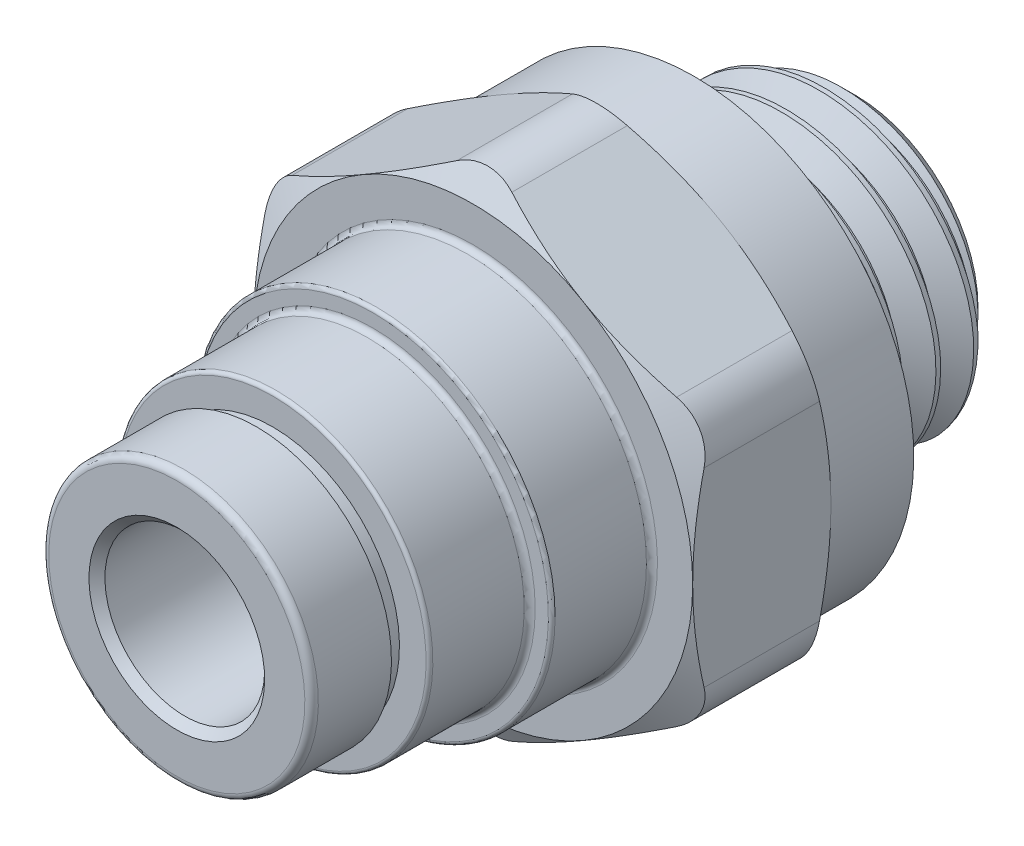
from build123d import *

# Parameters (mm, degrees)
SKETCH3_R               = 3.175
BOSS_EXTRUDE1_DEPTH     = 5.49275
SKETCH4_OUTSIDE_W       = 100.59
SKETCH4_OUTSIDE_H       = 103.292
SKETCH4_OUTSIDE_R       = 8.73125
CUT_EXTRUDE1_DEPTH      = 21.228952698
CUT_EXTRUDE1_DRAFT      = -60
MIRROR1_COPY_1_SKETCH_W = 100.59
MIRROR1_COPY_1_SKETCH_H = 103.292
MIRROR1_COPY_1_SKETCH_R = 8.73125
MIRROR1_COPY_1_DEPTH    = 21.228952698
MIRROR1_COPY_1_DRAFT    = -60
FILLET1_R               = 2.1828125
SPLIT1_SURFACE_1_BACK   = 38.591
SPLIT1_SURFACE_1_DEPTH  = 77.182
SPLIT1_SURFACE_2_BACK   = 38.591
SPLIT1_SURFACE_2_DEPTH  = 77.182
CUT_SWEEP1_PITCH        = 1.5
SKETCH5_OUTSIDE_W       = 88.964
SKETCH5_OUTSIDE_H       = 90.99
SKETCH5_OUTSIDE_R       = 4.863341658
CUT_EXTRUDE2_DEPTH      = 30.99185234
CUT_EXTRUDE2_DRAFT      = -45


with BuildPart() as part:
    # Sketch2 → Revolve1 (revolve)
    with BuildSketch(Plane(origin=(0, 0, 0), x_dir=(0, 0, -1), z_dir=(1, 0, 0))):
        with BuildLine():
            Line((-13.49375, 3.4925), (-13.49375, 5.09143))
            ThreePointArc((-13.49375, 5.09143), (-13.415263404, 5.280913404), (-13.22578, 5.3594))
            Line((-13.22578, 5.3594), (-10.31875, 5.3594))
            Line((-10.31875, 5.3594), (-10.31875, 5.0419))
            Line((-10.31875, 5.0419), (-9.68375, 5.0419))
            Line((-9.68375, 5.0419), (-9.68375, 6.101715))
            ThreePointArc((-9.68375, 6.101715), (-9.644506702, 6.196456702), (-9.549765, 6.2357))
            Line((-9.549765, 6.2357), (-5.918835, 6.2357))
            ThreePointArc((-5.918835, 6.2357), (-5.763925582, 6.299865582), (-5.69976, 6.454775))
            Line((-5.69976, 6.454775), (-5.69976, 6.978015))
            ThreePointArc((-5.69976, 6.978015), (-5.660516702, 7.072756702), (-5.565775, 7.112))
            Line((-5.565775, 7.112), (-1.934845, 7.112))
            ThreePointArc((-1.934845, 7.112), (-1.779935582, 7.176165582), (-1.71577, 7.331075))
            Line((-1.71577, 7.331075), (-1.71577, 8.73125))
            Line((-1.71577, 8.73125), (7.07263, 8.73125))
            Line((7.07263, 8.73125), (7.07263, 6.714276225))
            ThreePointArc((7.07263, 6.714276225), (7.385293212, 6.242576214), (7.197452843, 5.708745547))
            Line((7.197452843, 5.708745547), (7.497452843, 6))
            Line((7.497452843, 6), (13.49375, 6))
            Line((13.49375, 6), (13.49375, 2.3876))
            Line((13.49375, 2.3876), (1.44653, 2.3876))
            Line((1.44653, 2.3876), (1.44653, 3.175))
            Line((1.44653, 3.175), (-13.17625, 3.175))
            Line((-13.17625, 3.175), (-13.49375, 3.4925))
        make_face()
    revolve(axis=Axis((0, 0, -13.49375), (0, 0, 1)))

    # Sketch3 → Boss-Extrude1 (add)
    with BuildSketch(Plane.XY.offset(1.71577)):
        Polygon((0, 10.081979076), (-8.73125, 5.040989538), (-8.73125, -5.040989538), (0, -10.081979076), (8.73125, -5.040989538), (8.73125, 5.040989538), align=None)
        with Locations(Location((0, 0, 0), (0, 0, 90))):
            Circle(SKETCH3_R, mode=Mode.SUBTRACT)
    extrude(amount=-BOSS_EXTRUDE1_DEPTH)


with BuildPart() as cut_extrude1_tool:
    # Sketch4 outside → Cut-Extrude1 (with draft: the straight prism first)
    with BuildSketch(Plane.XY.offset(1.71577)):
        Rectangle(SKETCH4_OUTSIDE_W, SKETCH4_OUTSIDE_H)
        with Locations(Location((0, 0, 0), (0, 0, 90))):
            Circle(SKETCH4_OUTSIDE_R, mode=Mode.SUBTRACT)
    extrude(amount=-CUT_EXTRUDE1_DEPTH)
    # Cut-Extrude1: the draft: its side faces are tilted about the plane it starts from
    cut_extrude1_sides = [cut_extrude1_tool.faces().sort_by_distance(p)[0] for p in [
        (0, -51.646, -8.898706349),
        (50.295, 0, -8.898706349),
        (0, 51.646, -8.898706349),
        (-50.295, 0, -8.898706349),
        (0, -8.73125, -8.898706349),
    ]]
    draft(cut_extrude1_sides, Plane.XY.offset(1.71577), CUT_EXTRUDE1_DRAFT)


with BuildPart() as part_1:
    add(part.part)

    # Cut-Extrude1: cut by cut_extrude1_tool
    add(cut_extrude1_tool.part, mode=Mode.SUBTRACT)


with BuildPart() as mirror1_copy_1_tool:
    # Mirror1 copy 1 sketch → Mirror1 copy 1 (with draft: the straight prism first)
    with BuildSketch(Plane(origin=(0, 0, -3.77698), x_dir=(1, 0, 0), z_dir=(0, 0, -1))):
        Rectangle(MIRROR1_COPY_1_SKETCH_W, MIRROR1_COPY_1_SKETCH_H)
        Circle(MIRROR1_COPY_1_SKETCH_R, mode=Mode.SUBTRACT)
    extrude(amount=-MIRROR1_COPY_1_DEPTH)
    # Mirror1 copy 1: the draft: its side faces are tilted about the plane it starts from
    mirror1_copy_1_sides = [mirror1_copy_1_tool.faces().sort_by_distance(p)[0] for p in [
        (0, -51.646, 6.837496349),
        (50.295, 0, 6.837496349),
        (0, 51.646, 6.837496349),
        (-50.295, 0, 6.837496349),
        (0, -8.73125, 6.837496349),
    ]]
    draft(mirror1_copy_1_sides, Plane(origin=(0, 0, -3.77698), x_dir=(1, 0, 0), z_dir=(0, 0, -1)), MIRROR1_COPY_1_DRAFT)


with BuildPart() as part_2:
    add(part_1.part)

    # Mirror1 copy 1: cut by mirror1_copy_1_tool
    add(mirror1_copy_1_tool.part, mode=Mode.SUBTRACT)

    # Fillet1
    fillet1_edges = [part_2.edges().sort_by_distance(p)[0] for p in [
        (8.73125, -5.040989538, -1.030605),
        (0, -10.081979076, -1.030605),
        (-8.73125, -5.040989538, -1.030605),
        (-8.73125, 5.040989538, -1.030605),
        (0, 10.081979076, -1.030605),
        (8.73125, 5.040989538, -1.030605),
    ]]
    fillet(fillet1_edges, radius=FILLET1_R)


with BuildPart() as body_2:
    # Split1: the piece behind the surface
    add(part_2.part)
    # Split1 surface: a surface, the sketch's curves swept straight by 77.182 mm
    with BuildLine(Plane(origin=(0, 0, 0), x_dir=(0, 0, -1), z_dir=(1, 0, 0)).offset(-SPLIT1_SURFACE_1_BACK), mode=Mode.PRIVATE) as split1_surface_1_path:
        Line((7.39013, -13.096875), (7.39013, 13.096875))
    split1_surface_1 = Shell.extrude(split1_surface_1_path.wire(), (1 * SPLIT1_SURFACE_1_DEPTH, 0 * SPLIT1_SURFACE_1_DEPTH, 0 * SPLIT1_SURFACE_1_DEPTH))
    split(bisect_by=split1_surface_1, keep=Keep.BOTTOM)

    # Cut-Sweep1: the profile of Sketch7 screwed along a right-hand helix of 5.280747 turns, 8 arcs to a turn; built about Z, then put on its axis
    cut_sweep1_z = Axis((0, 0, 0), (0, 0, 1))
    cut_sweep1_corners = [(5.025721421, 0, -0.5625), (5.025721421, 0, -0.75), (6.081189882, 0, -1.359375), (6.081189882, 0, 0.046875)]
    with BuildLine(mode=Mode.PRIVATE) as cut_sweep1_profile:
        Line(cut_sweep1_corners[0], cut_sweep1_corners[1])
        Line(cut_sweep1_corners[1], cut_sweep1_corners[2])
        Line(cut_sweep1_corners[2], cut_sweep1_corners[3])
        Line(cut_sweep1_corners[3], cut_sweep1_corners[0])
    cut_sweep1_cap = Face(cut_sweep1_profile.wire())
    cut_sweep1_turn_angles = [0, 22.5, 45, 67.5, 90, 112.5, 135, 157.5, 180, 202.5, 225, 247.5, 270, 292.5, 315, 337.5, 360]
    cut_sweep1_turn_weights = [1, 0.9238795325112867, 1, 0.9238795325112867, 1, 0.9238795325112867, 1, 0.9238795325112867, 1, 0.9238795325112867, 1, 0.9238795325112867, 1, 0.9238795325112867, 1, 0.9238795325112867, 1]
    cut_sweep1_turn_rails = [Edge.make_bspline([Vector(p[0], p[1], 0).rotate(cut_sweep1_z, cut_sweep1_turn_angles[k]) / cut_sweep1_turn_weights[k] + Vector(0, 0, p[2] + CUT_SWEEP1_PITCH * cut_sweep1_turn_angles[k] / 360) for k in range(17)], [0, 0, 0, 1, 1, 2, 2, 3, 3, 4, 4, 5, 5, 6, 6, 7, 7, 8, 8, 8], 2, cut_sweep1_turn_weights) for p in cut_sweep1_corners]
    cut_sweep1_turn_sides = [Face.make_surface_from_curves(cut_sweep1_turn_rails[p[0]], cut_sweep1_turn_rails[p[1]]) for p in [(0, 1), (1, 2), (2, 3), (3, 0)]]
    cut_sweep1_turn = Solid(Shell([*cut_sweep1_turn_sides, cut_sweep1_cap, cut_sweep1_cap.rotate(cut_sweep1_z, 360).moved(Location((0, 0, CUT_SWEEP1_PITCH * 360 / 360)))]))
    cut_sweep1_last_angles = [1800, 1822.5, 1845, 1867.5, 1890, 1895.5344, 1901.0688]
    cut_sweep1_last_weights = [1, 0.9238795325112867, 1, 0.9238795325112867, 1, 0.9953384738202952, 1]
    cut_sweep1_last_rails = [Edge.make_bspline([Vector(p[0], p[1], 0).rotate(cut_sweep1_z, cut_sweep1_last_angles[k]) / cut_sweep1_last_weights[k] + Vector(0, 0, p[2] + CUT_SWEEP1_PITCH * cut_sweep1_last_angles[k] / 360) for k in range(7)], [0, 0, 0, 1, 1, 2, 2, 3, 3, 3], 2, cut_sweep1_last_weights) for p in cut_sweep1_corners]
    cut_sweep1_last_sides = [Face.make_surface_from_curves(cut_sweep1_last_rails[p[0]], cut_sweep1_last_rails[p[1]]) for p in [(0, 1), (1, 2), (2, 3), (3, 0)]]
    cut_sweep1_last = Solid(Shell([*cut_sweep1_last_sides, cut_sweep1_cap.rotate(cut_sweep1_z, 1800).moved(Location((0, 0, CUT_SWEEP1_PITCH * 1800 / 360))), cut_sweep1_cap.rotate(cut_sweep1_z, 1901.0688).moved(Location((0, 0, CUT_SWEEP1_PITCH * 1901.0688 / 360)))]))
    cut_sweep1_each = [*[cut_sweep1_turn.moved(Location((0, 0, CUT_SWEEP1_PITCH * i))) for i in range(5)], cut_sweep1_last]
    add(Plane(origin=(0, 0, -13.49375), x_dir=(0, 1, 0), z_dir=(0, 0, 1)) * Compound([cut_sweep1_each[i] for i in range(0, 6, 2)]), mode=Mode.SUBTRACT)
    add(Plane(origin=(0, 0, -13.49375), x_dir=(0, 1, 0), z_dir=(0, 0, 1)) * Compound([cut_sweep1_each[i] for i in range(1, 6, 2)]), mode=Mode.SUBTRACT)


with BuildPart() as part_3:
    add(part_2.part)

    # Split1: split by a surface, the side it looks to stays
    # Split1 surface: a surface, the sketch's curves swept straight by 77.182 mm
    with BuildLine(Plane(origin=(0, 0, 0), x_dir=(0, 0, -1), z_dir=(1, 0, 0)).offset(-SPLIT1_SURFACE_2_BACK), mode=Mode.PRIVATE) as split1_surface_2_path:
        Line((7.39013, -13.096875), (7.39013, 13.096875))
    split1_surface_2 = Shell.extrude(split1_surface_2_path.wire(), (1 * SPLIT1_SURFACE_2_DEPTH, 0 * SPLIT1_SURFACE_2_DEPTH, 0 * SPLIT1_SURFACE_2_DEPTH))
    split(bisect_by=split1_surface_2, keep=Keep.TOP)


with BuildPart() as cut_extrude2_tool:
    # Sketch5 outside → Cut-Extrude2 (with draft: the straight prism first)
    with BuildSketch(Plane(origin=(0, 0, -13.49375), x_dir=(-1, 0, 0), z_dir=(0, 0, -1))):
        Rectangle(SKETCH5_OUTSIDE_W, SKETCH5_OUTSIDE_H)
        Circle(SKETCH5_OUTSIDE_R, mode=Mode.SUBTRACT)
    extrude(amount=-CUT_EXTRUDE2_DEPTH)
    # Cut-Extrude2: the draft: its side faces are tilted about the plane it starts from
    cut_extrude2_sides = [cut_extrude2_tool.faces().sort_by_distance(p)[0] for p in [
        (0, -45.495, 2.00217617),
        (-44.482, 0, 2.00217617),
        (0, 45.495, 2.00217617),
        (44.482, 0, 2.00217617),
        (4.863341658, 0, 2.00217617),
    ]]
    draft(cut_extrude2_sides, Plane(origin=(0, 0, -13.49375), x_dir=(-1, 0, 0), z_dir=(0, 0, -1)), CUT_EXTRUDE2_DRAFT)


with BuildPart() as body_2_1:
    add(body_2.part)

    # Cut-Extrude2: cut by cut_extrude2_tool
    add(cut_extrude2_tool.part, mode=Mode.SUBTRACT)


with BuildPart() as part_4:
    add(part_3.part)

    # Combine1: union body 2
    add(body_2_1.part)


solid = part_4.part
